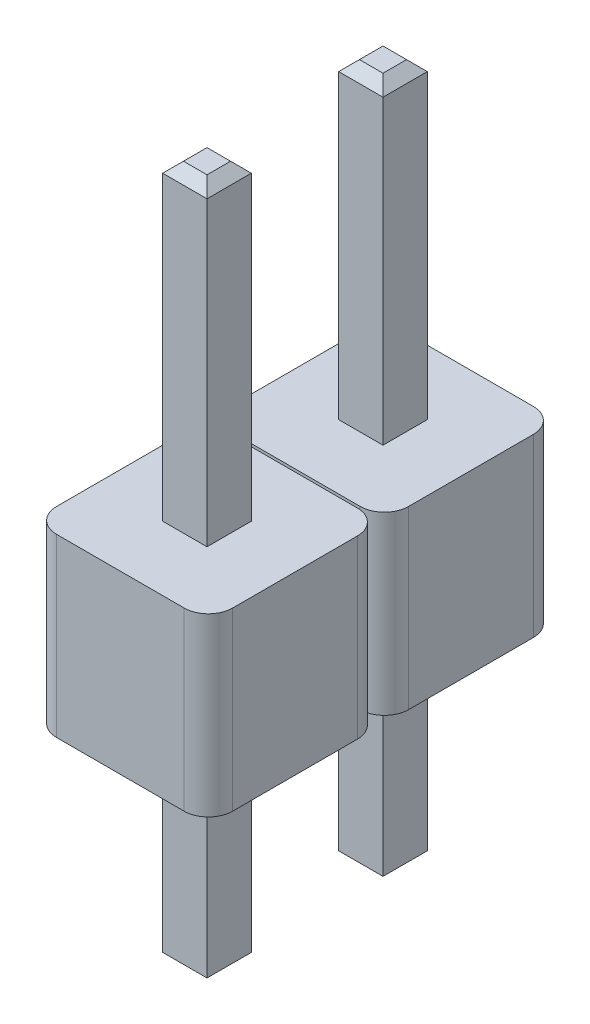
from build123d import *

# Parameters (mm, degrees)
SKETCH1_W           = 0.64
SKETCH1_H           = 0.64
BOSS_EXTRUDE1_DEPTH = 10.04
CHAMFER1_SIZE       = 0.15
BOSS_EXTRUDE2_DEPTH = 2.54
LPATTERN2_COUNT     = 2
LPATTERN2_PITCH     = 2.54


with BuildPart() as part:
    # Sketch1 → Boss-Extrude1 (new body)
    with BuildSketch(Plane(origin=(0, 0, 0), x_dir=(1, 0, 0), z_dir=(0, 1, 0))):
        with Locations((0.32, 0.32)):
            Rectangle(SKETCH1_W, SKETCH1_H)
    extrude(amount=BOSS_EXTRUDE1_DEPTH)

    # Chamfer1
    chamfer1_edges = [part.edges().sort_by_distance(p)[0] for p in [
        (0.32, 0, 0),
        (0.64, 0, -0.32),
        (0.32, 0, -0.64),
        (0, 0, -0.32),
        (0.32, 10.04, -0.64),
        (0.64, 10.04, -0.32),
        (0.32, 10.04, 0),
        (0, 10.04, -0.32),
    ]]
    chamfer(chamfer1_edges, length=CHAMFER1_SIZE)

    # Sketch3 → Boss-Extrude2 (add)
    with BuildSketch(Plane(origin=(0, 5.54, 0), x_dir=(1, 0, 0), z_dir=(0, 1, 0))):
        with BuildLine():
            Line((-0.6, -0.93), (1.24, -0.93))
            ThreePointArc((1.24, -0.93), (1.487487373, -0.827487373), (1.59, -0.58))
            Line((1.59, -0.58), (1.59, 1.22))
            ThreePointArc((1.59, 1.22), (1.487487373, 1.467487373), (1.24, 1.57))
            Line((1.24, 1.57), (-0.6, 1.57))
            ThreePointArc((-0.6, 1.57), (-0.847487373, 1.467487373), (-0.95, 1.22))
            Line((-0.95, 1.22), (-0.95, -0.58))
            ThreePointArc((-0.95, -0.58), (-0.847487373, -0.827487373), (-0.6, -0.93))
        make_face()
    extrude(amount=-BOSS_EXTRUDE2_DEPTH)


with BuildPart() as lpattern2_1:
    # LPattern2: pattern copy
    add(part.part.moved(Location(Vector(0, 0, -1) * (1 * LPATTERN2_PITCH))))


solid = Compound([part.part, lpattern2_1.part])
